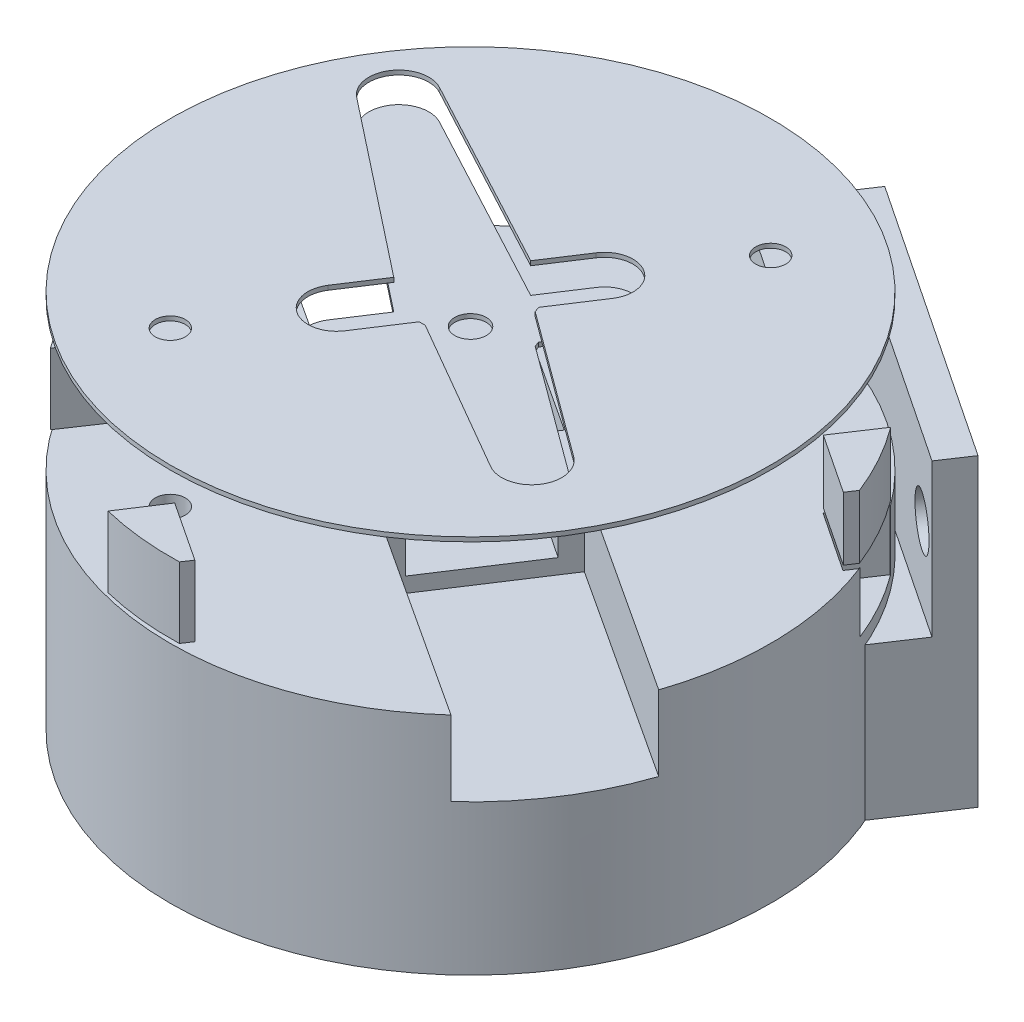
from build123d import *
from build123d.topology import SkipClean

# Parameters (mm, degrees)
SERVO_CONNECTOR_1_START         = 0.290796426
SERVO_CONNECTOR_1_OUTLINE_R     = 20
SERVO_CONNECTOR_1_OUTLINE_R_2   = 1
SERVO_CONNECTOR_1_DEPTH         = 10
SERVO_CONNECTOR_1_START_2       = -4.709203574
SERVO_CONNECTOR_1_2_DEPTH       = 13
SERVO_CONNECTOR_1_3_DEPTH       = 8
SERVO_CONNECTOR_1_START_3       = 6.290796426
SERVO_CONNECTOR_1_4_OUTLINE_R   = 2.3
SERVO_CONNECTOR_1_4_OUTLINE_R_2 = 1.05
SERVO_CONNECTOR_1_4_DEPTH       = 2
SKETCH5_R                       = 20
SKETCH5_R_2                     = 1
BOSS_EXTRUDE1_DEPTH             = 15
CAVITY1_OUTLINE_R               = 1
CAVITY1_DEPTH                   = 10
CAVITY1_START                   = -5
CAVITY1_2_DEPTH                 = 13
CAVITY1_START_2                 = 0.290796426
CAVITY1_3_OUTLINE_R             = 1.05
CAVITY1_3_DEPTH                 = 7.709203574
CAVITY1_START_3                 = 5
CAVITY1_4_DEPTH                 = 5
CAVITY1_START_4                 = 4.5
CAVITY1_5_DEPTH                 = 0.5
CUT_EXTRUDE1_DEPTH              = 4
SKETCH10_W                      = 22.399999201
SKETCH10_H                      = 20.28957609
SKETCH10_R                      = 2.263885391
SKETCH10_R_2                    = 1.680773428
SKETCH10_R_3                    = 1.58384996
BOSS_EXTRUDE2_DEPTH             = 4.5
SKETCH18_W                      = 22.399999201
SKETCH18_H                      = 10.125559165
SKETCH18_R                      = 2.263885391
BOSS_EXTRUDE26_DEPTH            = 5
CUT_EXTRUDE2_DEPTH              = 4
SKETCH22_W                      = 22.399999201
SKETCH22_H                      = 20.28957609
SKETCH22_R                      = 1.680773428
SKETCH22_R_2                    = 1.58384996
SKETCH22_R_3                    = 2.263885391
CUT_EXTRUDE3_DEPTH              = 2.29


# Read off the part's stored shape, not the designer's step: Servo_Connector_1, Cavity1
with BuildPart() as part:
    # Servo_Connector_1 outline → Servo_Connector_1 (new body)
    with BuildSketch(Plane(origin=(0, 0, 0), x_dir=(1, 0, 0), z_dir=(0, 1, 0)).offset(SERVO_CONNECTOR_1_START)):
        with Locations((-14.553676836, 2.400467292)):
            Circle(SERVO_CONNECTOR_1_OUTLINE_R)
        with BuildLine():
            Line((-11.254907871, 3.410726325), (-1.607838516, -3.671937294))
            ThreePointArc((-1.607838516, -3.671937294), (-1.117112712, -6.377986132), (-3.792356246, -7.015625657))
            Line((-3.792356246, -7.015625657), (-14.153711806, -1.026269928))
            Line((-14.153711806, -1.026269928), (-14.538074231, -1.049497426))
            Line((-14.538074231, -1.049497426), (-16.490845232, -4.038467294))
            ThreePointArc((-16.490845232, -4.038467294), (-19.120660394, -4.589894729), (-19.672087828, -1.960079567))
            Line((-19.672087828, -1.960079567), (-17.946670336, 0.680896201))
            Line((-17.946670336, 0.680896201), (-29.562325044, 9.826299163))
            ThreePointArc((-29.562325044, 9.826299163), (-29.999446811, 12.49158665), (-27.383064246, 13.161941108))
            Line((-27.383064246, 13.161941108), (-14.341925933, 6.198426111))
            Line((-14.341925933, 6.198426111), (-12.61650844, 8.839401879))
            ThreePointArc((-12.61650844, 8.839401879), (-9.986693279, 9.390829313), (-9.435265844, 6.761014152))
            Line((-9.435265844, 6.761014152), (-11.388036845, 3.772044284))
            Line((-11.388036845, 3.772044284), (-11.254907871, 3.410726325))
        make_face(mode=Mode.SUBTRACT)
        with Locations((-6.650334033, 14.49756085)):
            Circle(SERVO_CONNECTOR_1_OUTLINE_R_2, mode=Mode.SUBTRACT)
        with Locations((-22.457019639, -9.696626265)):
            Circle(SERVO_CONNECTOR_1_OUTLINE_R_2, mode=Mode.SUBTRACT)
    extrude(amount=SERVO_CONNECTOR_1_DEPTH)

    # Servo_Connector_1 2 outline → Servo_Connector_1 2 (add)
    with SkipClean():  # the faces are left unmerged after this step: merging them gives an invalid solid
        with BuildSketch(Plane(origin=(0, 0, 0), x_dir=(1, 0, 0), z_dir=(0, 1, 0)).offset(SERVO_CONNECTOR_1_START_2)):
            with BuildLine():
                Line((-13.744445083, 7.844284333), (-28.030666138, 17.177840515))
                ThreePointArc((-28.030666138, 17.177840515), (-31.297058922, 13.339350064), (-33.500107524, 8.806149471))
                Line((-33.500107524, 8.806149471), (-19.213886469, -0.527406711))
                Line((-19.213886469, -0.527406711), (-13.744445083, 7.844284333))
            make_face()
            with BuildLine():
                Line((-15.362908589, -3.043349748), (-1.076687534, -12.37690593))
                ThreePointArc((-1.076687534, -12.37690593), (2.189705251, -8.53841548), (4.392753852, -4.005214887))
                Line((4.392753852, -4.005214887), (-9.893467203, 5.328341295))
                Line((-9.893467203, 5.328341295), (-15.362908589, -3.043349748))
            make_face()
        extrude(amount=SERVO_CONNECTOR_1_2_DEPTH)

    # Servo_Connector_1 3 outline → Servo_Connector_1 3 (add)
    with SkipClean():  # the faces are left unmerged after this step: merging them gives an invalid solid
        with BuildSketch(Plane(origin=(0, 0, 0), x_dir=(1, 0, 0), z_dir=(0, 1, 0)).offset(SERVO_CONNECTOR_1_START)):
            with BuildLine():
                ThreePointArc((-16.479165734, 3.658438876), (-13.29571537, 4.3259628), (-12.628174718, 1.142515943))
                Line((-12.628174718, 1.142515943), (-11.181503427, 3.356834416))
                Line((-11.181503427, 3.356834416), (-11.254907871, 3.410726325))
                Line((-11.254907871, 3.410726325), (-11.388036845, 3.772044284))
                Line((-11.388036845, 3.772044284), (-9.435265844, 6.761014152))
                ThreePointArc((-9.435265844, 6.761014152), (-9.986693279, 9.390829313), (-12.61650844, 8.839401879))
                Line((-12.61650844, 8.839401879), (-14.341925933, 6.198426111))
                Line((-14.341925933, 6.198426111), (-14.696153283, 6.387571215))
                Line((-14.696153283, 6.387571215), (-16.479165734, 3.658438876))
            make_face()
            with BuildLine():
                ThreePointArc((-12.628174718, 1.142515943), (-15.811638302, 0.474971784), (-16.479165734, 3.658438876))
                Line((-16.479165734, 3.658438876), (-18.262178269, 0.929306407))
                Line((-18.262178269, 0.929306407), (-17.946670336, 0.680896201))
                Line((-17.946670336, 0.680896201), (-19.672087828, -1.960079567))
                ThreePointArc((-19.672087828, -1.960079567), (-19.120660394, -4.589894729), (-16.490845232, -4.038467294))
                Line((-16.490845232, -4.038467294), (-14.538074231, -1.049497426))
                Line((-14.538074231, -1.049497426), (-14.153711806, -1.026269928))
                Line((-14.153711806, -1.026269928), (-14.074872366, -1.07184287))
                Line((-14.074872366, -1.07184287), (-12.628174718, 1.142515943))
            make_face()
        extrude(amount=SERVO_CONNECTOR_1_3_DEPTH)

    # Servo_Connector_1 4 outline → Servo_Connector_1 4 (add)
    with SkipClean():  # the faces are left unmerged after this step: merging them gives an invalid solid
        with BuildSketch(Plane(origin=(0, 0, 0), x_dir=(1, 0, 0), z_dir=(0, 1, 0)).offset(SERVO_CONNECTOR_1_START_3)):
            with Locations((-14.553676836, 2.400467292)):
                Circle(SERVO_CONNECTOR_1_4_OUTLINE_R)
            with Locations((-14.553676836, 2.400467292)):
                Circle(SERVO_CONNECTOR_1_4_OUTLINE_R_2, mode=Mode.SUBTRACT)
        extrude(amount=SERVO_CONNECTOR_1_4_DEPTH)

    # Cavity1 outline → Cavity1 (cut)
    with BuildSketch(Plane(origin=(0, 0, 0), x_dir=(1, 0, 0), z_dir=(0, 1, 0))):
        with BuildLine():
            ThreePointArc((-15.069772054, 22.393807326), (-31.218538546, 13.458603853), (-33.176320371, -4.893170193))
            Line((-33.176320371, -4.893170193), (-32.746870213, -4.245291305))
            Line((-32.746870213, -4.245291305), (-28.785286033, -6.875758097))
            Line((-28.785286033, -6.875758097), (-30.586583313, -9.555531616))
            ThreePointArc((-30.586583313, -9.555531616), (-25.581564287, -14.284427025), (-19.269391365, -17.035634078))
            Line((-19.269391365, -17.035634078), (-17.512656353, -14.347883968))
            Line((-17.512656353, -14.347883968), (-13.546919726, -16.972086279))
            Line((-13.546919726, -16.972086279), (-13.956923486, -17.590627862))
            ThreePointArc((-13.956923486, -17.590627862), (2.133251073, -8.624342773), (4.069240241, 9.693406312))
            Line((4.069240241, 9.693406312), (3.639516541, 9.046225889))
            Line((3.639516541, 9.046225889), (-0.32206764, 11.676692681))
            Line((-0.32206764, 11.676692681), (1.453816138, 14.351241968))
            Line((1.453816138, 14.351241968), (1.511688907, 14.312814817))
            ThreePointArc((1.511688907, 14.312814817), (-3.459831348, 19.041578802), (-9.737020182, 21.811799515))
            Line((-9.737020182, 21.811799515), (-11.522802686, 19.143849379))
            Line((-11.522802686, 19.143849379), (-15.474612102, 21.788978318))
            Line((-15.474612102, 21.788978318), (-15.069772054, 22.393807326))
        make_face()
        with BuildLine():
            Line((-14.341925933, 6.198426111), (-12.61650844, 8.839401879))
            ThreePointArc((-12.61650844, 8.839401879), (-9.986693279, 9.390829313), (-9.435265844, 6.761014152))
            Line((-9.435265844, 6.761014152), (-11.388036845, 3.772044284))
            Line((-11.388036845, 3.772044284), (-11.254907871, 3.410726325))
            Line((-11.254907871, 3.410726325), (-1.607838516, -3.671937294))
            ThreePointArc((-1.607838516, -3.671937294), (-1.117112712, -6.377986132), (-3.792356246, -7.015625657))
            Line((-3.792356246, -7.015625657), (-14.153711806, -1.026269928))
            Line((-14.153711806, -1.026269928), (-14.538074231, -1.049497426))
            Line((-14.538074231, -1.049497426), (-16.490845232, -4.038467294))
            ThreePointArc((-16.490845232, -4.038467294), (-19.120660394, -4.589894729), (-19.672087828, -1.960079567))
            Line((-19.672087828, -1.960079567), (-17.946670336, 0.680896201))
            Line((-17.946670336, 0.680896201), (-29.562325044, 9.826299163))
            ThreePointArc((-29.562325044, 9.826299163), (-29.999446811, 12.49158665), (-27.383064246, 13.161941108))
            Line((-27.383064246, 13.161941108), (-14.341925933, 6.198426111))
        make_face(mode=Mode.SUBTRACT)
        with Locations((-6.650334033, 14.49756085)):
            Circle(CAVITY1_OUTLINE_R, mode=Mode.SUBTRACT)
        with Locations((-22.457019639, -9.696626265)):
            Circle(CAVITY1_OUTLINE_R, mode=Mode.SUBTRACT)
    extrude(amount=CAVITY1_DEPTH, mode=Mode.SUBTRACT)


with BuildPart() as body_2:
    # Sketch5 → Boss-Extrude1 (new body)
    with BuildSketch(Plane(origin=(0, 0, 0), x_dir=(1, 0, 0), z_dir=(0, 1, 0))):
        with Locations(Location((-14.553676836, 2.400467292, 0), (0, 0, 270))):
            Circle(SKETCH5_R)
        with Locations(Location((-6.650334033, 14.49756085, 0), (0, 0, 270))):
            Circle(SKETCH5_R_2, mode=Mode.SUBTRACT)
        with Locations(Location((-22.457019639, -9.696626265, 0), (0, 0, 270))):
            Circle(SKETCH5_R_2, mode=Mode.SUBTRACT)
    extrude(amount=-BOSS_EXTRUDE1_DEPTH)


with BuildPart() as cavity1_2_tool:
    # Cavity1 2 outline → Cavity1 2 (new body)
    with BuildSketch(Plane(origin=(0, 0, 0), x_dir=(1, 0, 0), z_dir=(0, 1, 0)).offset(CAVITY1_START)):
        with BuildLine():
            Line((-13.739778259, 7.841235377), (-28.030666138, 17.177840515))
            ThreePointArc((-28.030666138, 17.177840515), (-31.297058922, 13.339350064), (-33.500107524, 8.806149471))
            Line((-33.500107524, 8.806149471), (-19.209219645, -0.530455667))
            Line((-19.209219645, -0.530455667), (-13.739778259, 7.841235377))
        make_face()
        with BuildLine():
            Line((-15.367575413, -3.040300792), (-1.076687534, -12.37690593))
            ThreePointArc((-1.076687534, -12.37690593), (2.189705251, -8.53841548), (4.392753852, -4.005214887))
            Line((4.392753852, -4.005214887), (-9.898134027, 5.331390251))
            Line((-9.898134027, 5.331390251), (-15.367575413, -3.040300792))
        make_face()
    extrude(amount=CAVITY1_2_DEPTH)


with BuildPart() as part_1:
    add(part.part)

    # Cavity1 2: cut by cavity1_2_tool
    add(cavity1_2_tool.part, mode=Mode.SUBTRACT)

    # Cavity1 3 outline → Cavity1 3 (cut)
    with BuildSketch(Plane(origin=(0, 0, 0), x_dir=(1, 0, 0), z_dir=(0, 1, 0)).offset(CAVITY1_START_2)):
        with BuildLine():
            Line((-12.61650844, 8.839401879), (-14.341925933, 6.198426111))
            Line((-14.341925933, 6.198426111), (-14.691216656, 6.384935228))
            Line((-14.691216656, 6.384935228), (-18.257781248, 0.925844482))
            Line((-18.257781248, 0.925844482), (-17.946670336, 0.680896201))
            Line((-17.946670336, 0.680896201), (-19.672087828, -1.960079567))
            ThreePointArc((-19.672087828, -1.960079567), (-19.120660394, -4.589894729), (-16.490845232, -4.038467294))
            Line((-16.490845232, -4.038467294), (-14.538074231, -1.049497426))
            Line((-14.538074231, -1.049497426), (-14.153711806, -1.026269928))
            Line((-14.153711806, -1.026269928), (-14.079705792, -1.06904892))
            Line((-14.079705792, -1.06904892), (-11.186003648, 3.360138378))
            Line((-11.186003648, 3.360138378), (-11.254907871, 3.410726325))
            Line((-11.254907871, 3.410726325), (-11.388036845, 3.772044284))
            Line((-11.388036845, 3.772044284), (-9.435265844, 6.761014152))
            ThreePointArc((-9.435265844, 6.761014152), (-9.986693279, 9.390829313), (-12.61650844, 8.839401879))
        make_face()
        with Locations((-14.553676836, 2.400467292)):
            Circle(CAVITY1_3_OUTLINE_R, mode=Mode.SUBTRACT)
    extrude(amount=CAVITY1_3_DEPTH, mode=Mode.SUBTRACT)

    # Cavity1 4 outline → Cavity1 4 (cut)
    with BuildSketch(Plane(origin=(0, 0, 0), x_dir=(1, 0, 0), z_dir=(0, 1, 0)).offset(CAVITY1_START_3)):
        with BuildLine():
            ThreePointArc((-9.737020182, 21.811799515), (-12.38379425, 22.282409088), (-15.069772054, 22.393807326))
            Line((-15.069772054, 22.393807326), (-15.474612102, 21.788978318))
            Line((-15.474612102, 21.788978318), (-11.522802686, 19.143849379))
            Line((-11.522802686, 19.143849379), (-9.737020182, 21.811799515))
        make_face()
        with BuildLine():
            Line((-32.746870213, -4.245291305), (-33.176320371, -4.893170193))
            ThreePointArc((-33.176320371, -4.893170193), (-32.037560563, -7.311062445), (-30.586583313, -9.555531616))
            Line((-30.586583313, -9.555531616), (-28.785286033, -6.875758097))
            Line((-28.785286033, -6.875758097), (-32.746870213, -4.245291305))
        make_face()
        with BuildLine():
            ThreePointArc((4.069240241, 9.693406312), (2.943579377, 12.087883099), (1.511688907, 14.312814817))
            Line((1.511688907, 14.312814817), (1.453816138, 14.351241968))
            Line((1.453816138, 14.351241968), (-0.32206764, 11.676692681))
            Line((-0.32206764, 11.676692681), (3.639516541, 9.046225889))
            Line((3.639516541, 9.046225889), (4.069240241, 9.693406312))
        make_face()
        with BuildLine():
            Line((-17.512656353, -14.347883968), (-19.269391365, -17.035634078))
            ThreePointArc((-19.269391365, -17.035634078), (-16.631768466, -17.491278111), (-13.956923486, -17.590627862))
            Line((-13.956923486, -17.590627862), (-13.546919726, -16.972086279))
            Line((-13.546919726, -16.972086279), (-17.512656353, -14.347883968))
        make_face()
    extrude(amount=CAVITY1_4_DEPTH, mode=Mode.SUBTRACT)

    # Cavity1 5 outline → Cavity1 5 (cut)
    with BuildSketch(Plane(origin=(0, 0, 0), x_dir=(1, 0, 0), z_dir=(0, 1, 0)).offset(CAVITY1_START_4)):
        with BuildLine():
            ThreePointArc((-9.737020182, 21.811799515), (-12.38379425, 22.282409088), (-15.069772054, 22.393807326))
            Line((-15.069772054, 22.393807326), (-15.474612102, 21.788978318))
            Line((-15.474612102, 21.788978318), (-11.522802686, 19.143849379))
            Line((-11.522802686, 19.143849379), (-9.737020182, 21.811799515))
        make_face()
        with BuildLine():
            ThreePointArc((4.069240241, 9.693406312), (2.943579377, 12.087883099), (1.511688907, 14.312814817))
            Line((1.511688907, 14.312814817), (1.453816138, 14.351241968))
            Line((1.453816138, 14.351241968), (-0.32206764, 11.676692681))
            Line((-0.32206764, 11.676692681), (3.639516541, 9.046225889))
            Line((3.639516541, 9.046225889), (4.069240241, 9.693406312))
        make_face()
    extrude(amount=CAVITY1_5_DEPTH, mode=Mode.SUBTRACT)


with BuildPart() as body_2_1:
    add(body_2.part)

    # Cavity1 2: cut by cavity1_2_tool
    add(cavity1_2_tool.part, mode=Mode.SUBTRACT)

    # Sketch8 → Cut-Extrude1 (cut)
    with BuildSketch(Plane(origin=(0, 0, 0), x_dir=(1, 0, 0), z_dir=(0, 1, 0))):
        Polygon((-18.792542403, 0.90165554), (-14.158020196, -2.188025931), (-10.078056202, 3.93192006), (-14.712578409, 7.021601531), align=None)
    extrude(amount=-CUT_EXTRUDE1_DEPTH, mode=Mode.SUBTRACT)

    # Sketch21 → Cut-Extrude2 (cut)
    with BuildSketch(Plane(origin=(0, 0, 0), x_dir=(1, 0, 0), z_dir=(0, 1, 0))):
        Polygon((-15.093006766, 22.39319405), (-15.501148384, 21.780981623), (-11.529771096, 19.133396765), (-9.743155086, 21.813320779), (-12.251021416, 23.268093801), align=None)
        Polygon((4.050482857, 9.630867635), (3.765011338, 12.590738631), (1.45757996, 14.346164081), (-0.32903605, 11.666240067), (3.642341239, 9.018655208), align=None)
    extrude(amount=-CUT_EXTRUDE2_DEPTH, mode=Mode.SUBTRACT)


with BuildPart() as body_3:
    # Sketch10 → Boss-Extrude2 (new body)
    with BuildSketch(Plane(origin=(7.723857494, 0, -11.585786242), x_dir=(0.8320502943378437, 0, 0.5547001962252291), z_dir=(-0.5547001962252291, 0, 0.8320502943378437))):
        with Locations((-13.779650256, -4.855211955)):
            Rectangle(SKETCH10_W, SKETCH10_H)
        with Locations((-13.784216706, -9.257754986)):
            Circle(SKETCH10_R, mode=Mode.SUBTRACT)
        with Locations((-4.981020949, 0.163064574)):
            Circle(SKETCH10_R_2, mode=Mode.SUBTRACT)
        with Locations((-22.579650208, 0.163064574)):
            Circle(SKETCH10_R_3, mode=Mode.SUBTRACT)
    extrude(amount=-BOSS_EXTRUDE2_DEPTH)


with BuildPart() as body_4:
    # Sketch18 → Boss-Extrude26 (new body)
    with BuildSketch(Plane(origin=(5.283176631, 0, -7.924764947), x_dir=(0.8320502943378437, 0, 0.554700196225229), z_dir=(-0.554700196225229, 0, 0.8320502943378437))):
        with Locations((-13.779650256, -9.937220418)):
            Rectangle(SKETCH18_W, SKETCH18_H)
        with Locations((-13.784216706, -9.257754986)):
            Circle(SKETCH18_R, mode=Mode.SUBTRACT)
    extrude(amount=-BOSS_EXTRUDE26_DEPTH)

    # Combine4: union body 3
    add(body_3.part)

    # Sketch22 → Cut-Extrude3 (cut)
    with BuildSketch(Plane(origin=(10.220008377, 0, -15.330012566), x_dir=(-0.8320502943378437, 0, -0.554700196225229), z_dir=(0.554700196225229, 0, -0.8320502943378437))):
        with Locations((13.779650256, -4.855211955)):
            Rectangle(SKETCH22_W, SKETCH22_H)
        with Locations(Location((4.981020949, 0.163064574, 0), (0, 0, 180))):
            Circle(SKETCH22_R, mode=Mode.SUBTRACT)
        with Locations(Location((22.579650208, 0.163064574, 0), (0, 0, 180))):
            Circle(SKETCH22_R_2, mode=Mode.SUBTRACT)
        with Locations(Location((13.784216706, -9.257754986, 0), (0, 0, 180))):
            Circle(SKETCH22_R_3, mode=Mode.SUBTRACT)
    extrude(amount=-CUT_EXTRUDE3_DEPTH, mode=Mode.SUBTRACT)


solid = Compound([part_1.part, body_2_1.part, body_4.part])
